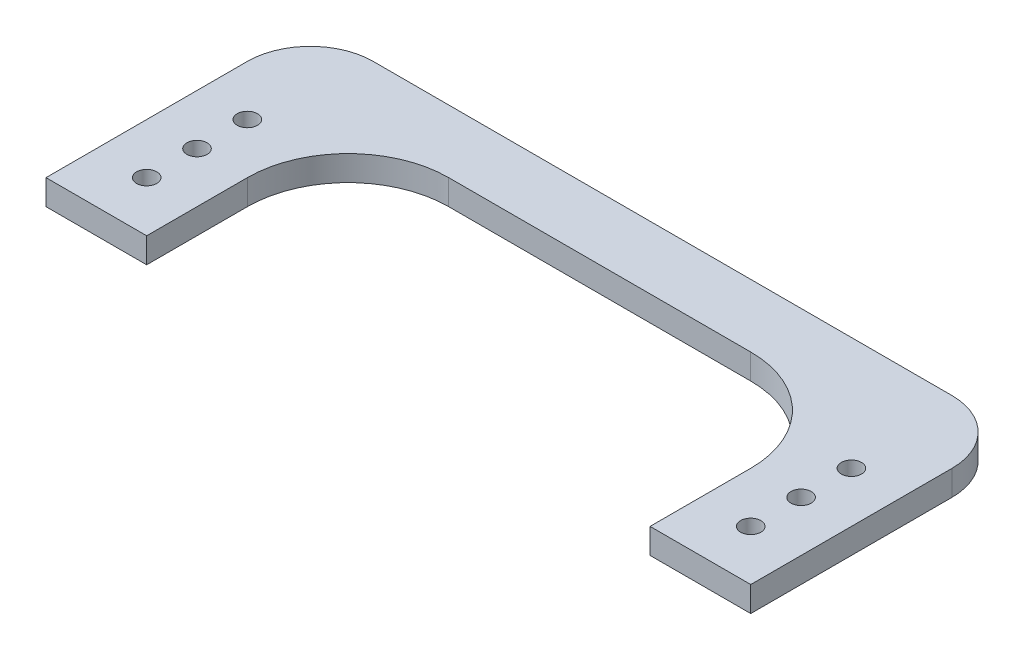
from build123d import *

# Parameters (mm, degrees)
BOSS_EXTRUDE1_DEPTH    = 6.35
F_10_CLEARANCE_HOLE1_D = 5.1054


with BuildPart() as part:
    # Sketch1 → Boss-Extrude1 (new body)
    with BuildSketch(Plane(origin=(0, 0, 0), x_dir=(1, 0, 0), z_dir=(0, 1, 0))):
        with BuildLine():
            Line((-63.5, -25.4), (-63.5, 0))
            ThreePointArc((-63.5, 0), (-56.060512242, 17.960512242), (-38.1, 25.4))
            Line((-38.1, 25.4), (38.1, 25.4))
            ThreePointArc((38.1, 25.4), (56.060512242, 17.960512242), (63.5, 0))
            Line((63.5, 0), (63.5, -25.4))
            Line((63.5, -25.4), (88.9, -25.4))
            Line((88.9, -25.4), (88.9, 25.4))
            ThreePointArc((88.9, 25.4), (84.250320151, 36.625320151), (73.025, 41.275))
            Line((73.025, 41.275), (-73.025, 41.275))
            ThreePointArc((-73.025, 41.275), (-84.250320151, 36.625320151), (-88.9, 25.4))
            Line((-88.9, 25.4), (-88.9, -25.4))
            Line((-88.9, -25.4), (-63.5, -25.4))
        make_face()
    extrude(amount=BOSS_EXTRUDE1_DEPTH)

    # #10 Clearance Hole1 (through all)
    with Locations(Plane(origin=(0, 6.35, 0), x_dir=(1, 0, 0), z_dir=(0, 1, 0))):
        with Locations((-76.2, -12.7), (-76.2, 0), (-76.2, 12.7), (76.2, 12.7), (76.2, 0), (76.2, -12.7)):
            Hole(F_10_CLEARANCE_HOLE1_D / 2)


solid = part.part
